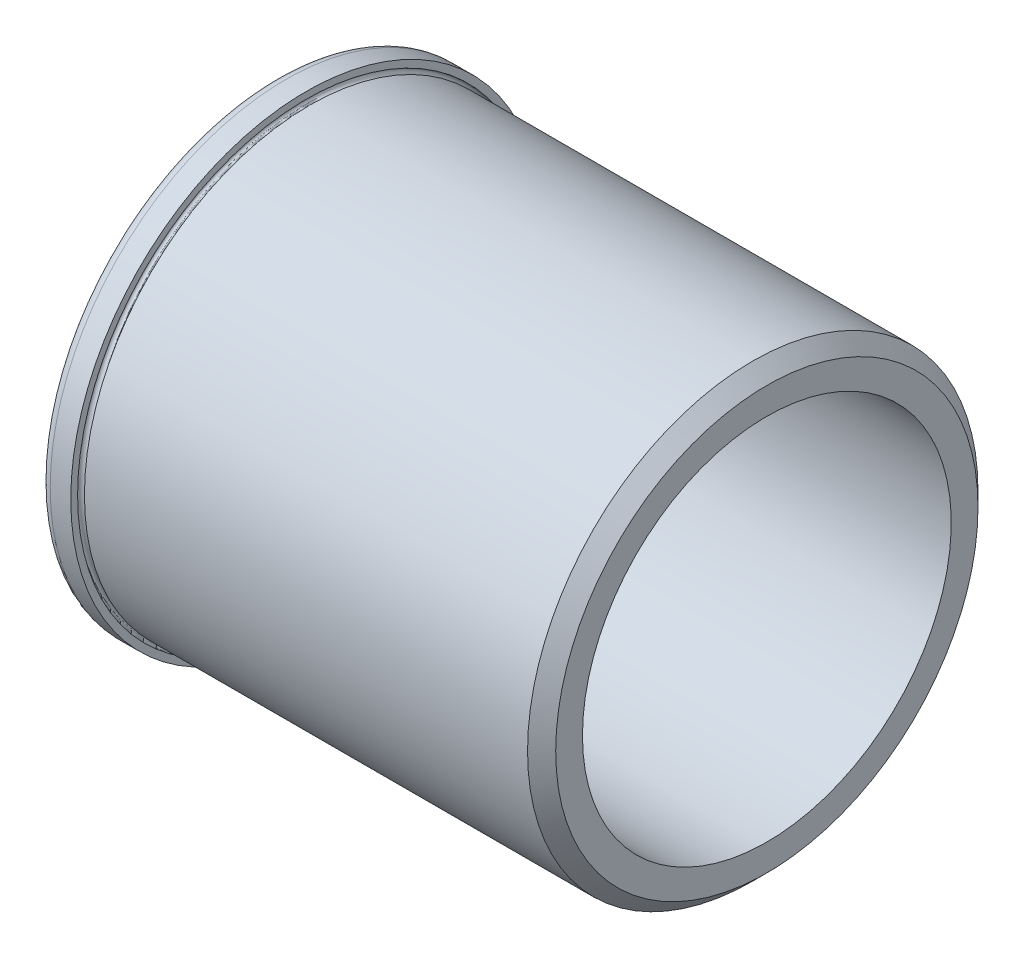
from build123d import *


with BuildPart() as part:
    # Sketch1 → BaseBody (revolve)
    with BuildSketch(Plane.XY):
        with BuildLine():
            Line((0, 31.76905), (0, 34.925))
            ThreePointArc((0, 34.925), (0.464967985, 36.047532015), (1.5875, 36.5125))
            Line((1.5875, 36.5125), (4.7752, 36.5125))
            Line((4.7752, 36.5125), (4.7752, 35.454166667))
            ThreePointArc((4.7752, 35.454166667), (4.401022662, 34.550822662), (5.304366667, 34.925))
            Line((5.304366667, 34.925), (74.0171875, 34.925))
            Line((74.0171875, 34.925), (76.2, 32.7421875))
            Line((76.2, 32.7421875), (76.2, 28.59405))
            Line((76.2, 28.59405), (3.175, 28.59405))
            ThreePointArc((3.175, 28.59405), (0.92993597, 29.52398597), (0, 31.76905))
        make_face()
    revolve(axis=Axis((0, 0, 0), (1, 0, 0)))


solid = part.part
